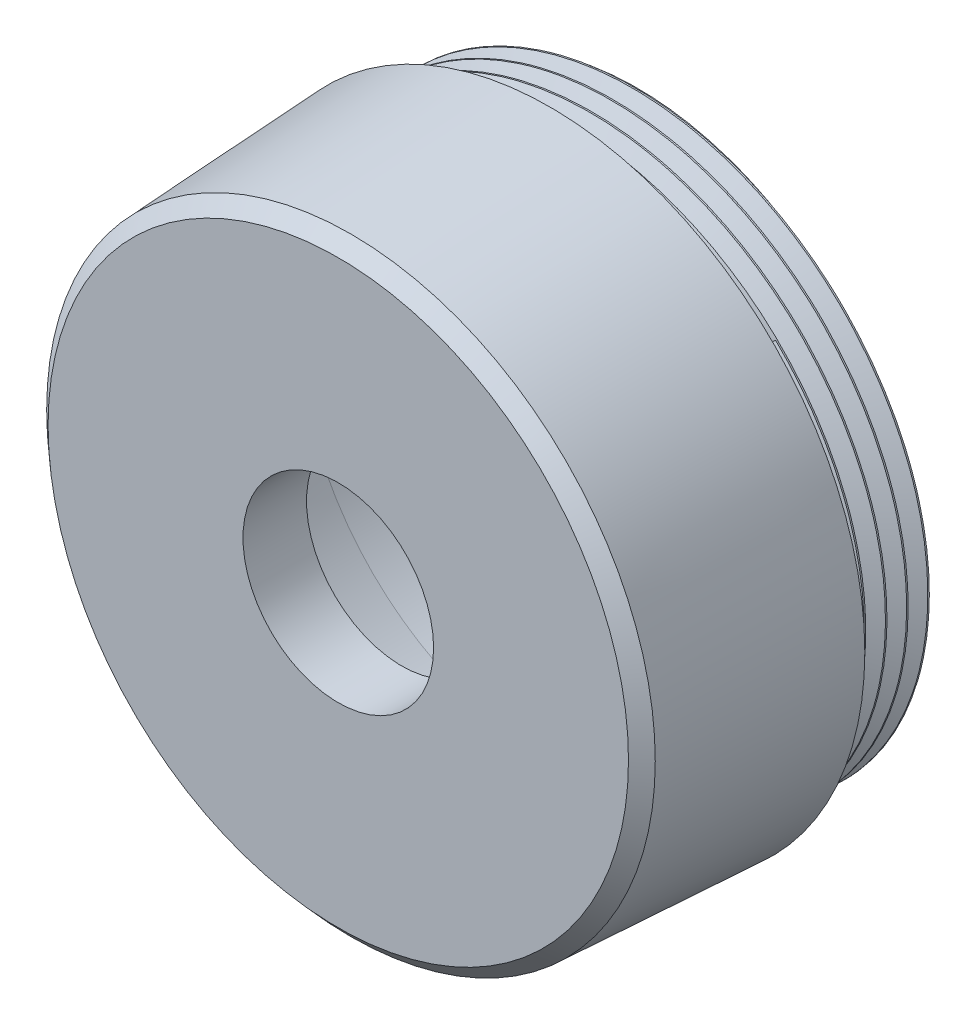
from build123d import *

# Parameters (mm, degrees)
SKETCH1_R           = 7.43
BOSS_EXTRUDE3_DEPTH = 5
BOSS_EXTRUDE3_TAPER = 3
SHELL1_T            = -1.5
SKETCH3_R           = 6.93
SKETCH3_R_2         = 5.927941481
BOSS_EXTRUDE4_DEPTH = 2.2
CUT_SWEEP1_PITCH    = 0.5
CHAMFER1_SIZE       = 0.3
CHAMFER1_SIZE_2     = 0.317026351
SKETCH7_R           = 2.25
CUT_EXTRUDE1_DEPTH  = 6


with BuildPart() as part:
    # Sketch1 → Boss-Extrude3 (new body)
    with BuildSketch(Plane.XY):
        Circle(SKETCH1_R)
    extrude(amount=BOSS_EXTRUDE3_DEPTH, taper=BOSS_EXTRUDE3_TAPER)

    # Shell1
    shell1_openings = [part.faces().sort_by_distance(p)[0] for p in [
        (0, 0, 0),
    ]]
    offset(amount=SHELL1_T, openings=shell1_openings, kind=Kind.INTERSECTION)


with BuildPart() as body_2:
    # Sketch3 → Boss-Extrude4 (new body)
    with BuildSketch(Plane(origin=(0, 0, 0), x_dir=(-1, 0, 0), z_dir=(0, 0, -1))):
        Circle(SKETCH3_R)
        Circle(SKETCH3_R_2, mode=Mode.SUBTRACT)
    extrude(amount=BOSS_EXTRUDE4_DEPTH)


with BuildPart() as part_1:
    add(part.part)

    # Combine1: union body 2
    add(body_2.part)

    # Cut-Sweep1: arcs per turn and ends read off the stored shape
    # Cut-Sweep1: the profile of Sketch6 screwed along a right-hand helix through 5 turns, 6 arcs to a turn; built about Z, then put on its axis
    cut_sweep1_z = Axis((0, 0, 0), (0, 0, 1))
    cut_sweep1_corners = [(6.527962418, -2.7236e-05, -0.497628173), (6.94947392, -0.002896154, -0.24778858), (6.955099869, 0.002729794, -0.737723981)]
    with BuildLine(mode=Mode.PRIVATE) as cut_sweep1_profile:
        Line(cut_sweep1_corners[0], cut_sweep1_corners[1])
        Line(cut_sweep1_corners[1], cut_sweep1_corners[2])
        Line(cut_sweep1_corners[2], cut_sweep1_corners[0])
    cut_sweep1_cap = Face(cut_sweep1_profile.wire())
    cut_sweep1_turn_angles = [0, 30, 60, 90, 120, 150, 180, 210, 240, 270, 300, 330, 360]
    cut_sweep1_turn_weights = [1, 0.8660254037844387, 1, 0.8660254037844387, 1, 0.8660254037844387, 1, 0.8660254037844387, 1, 0.8660254037844387, 1, 0.8660254037844387, 1]
    cut_sweep1_turn_rails = [Edge.make_bspline([Vector(p[0], p[1], 0).rotate(cut_sweep1_z, cut_sweep1_turn_angles[k]) / cut_sweep1_turn_weights[k] + Vector(0, 0, p[2] + CUT_SWEEP1_PITCH * cut_sweep1_turn_angles[k] / 360) for k in range(13)], [0, 0, 0, 1, 1, 2, 2, 3, 3, 4, 4, 5, 5, 6, 6, 6], 2, cut_sweep1_turn_weights) for p in cut_sweep1_corners]
    cut_sweep1_turn_sides = [Face.make_surface_from_curves(cut_sweep1_turn_rails[p[0]], cut_sweep1_turn_rails[p[1]]) for p in [(0, 1), (1, 2), (2, 0)]]
    cut_sweep1 = Plane(origin=(0, 0, -2.2), x_dir=(0.7071067811865512, 0.7071067811865438, 0), z_dir=(0, 0, 1)) * Solid(Shell([*[p.moved(Location((0, 0, CUT_SWEEP1_PITCH * i))) for i in range(5) for p in cut_sweep1_turn_sides], cut_sweep1_cap, cut_sweep1_cap.rotate(cut_sweep1_z, 1800).moved(Location((0, 0, CUT_SWEEP1_PITCH * 1800 / 360)))]))
    add(cut_sweep1, mode=Mode.SUBTRACT)

    # Chamfer1
    # the kernel refuses this chamfer: 0.317026351, 0.3 mm, written as the material it takes off along each edge
    with BuildSketch(Plane(origin=(0, 0, 5), x_dir=(1, 0, 0), z_dir=(0, 1, 0))) as chamfer1_piece_1:
        Polygon((7.167961104 + CHAMFER1_SIZE * 0.0523359562429, CHAMFER1_SIZE * 0.998629534755), (7.167961104 - CHAMFER1_SIZE_2, 0), (7.167961104, 0), align=None)
    revolve(axis=Axis((0, 0, 5), (0, 0, -1)), mode=Mode.SUBTRACT)

    # Sketch7 → Cut-Extrude1 (cut)
    with BuildSketch(Plane.XY.offset(5)):
        Circle(SKETCH7_R)
    extrude(amount=-CUT_EXTRUDE1_DEPTH, mode=Mode.SUBTRACT)


solid = part_1.part
